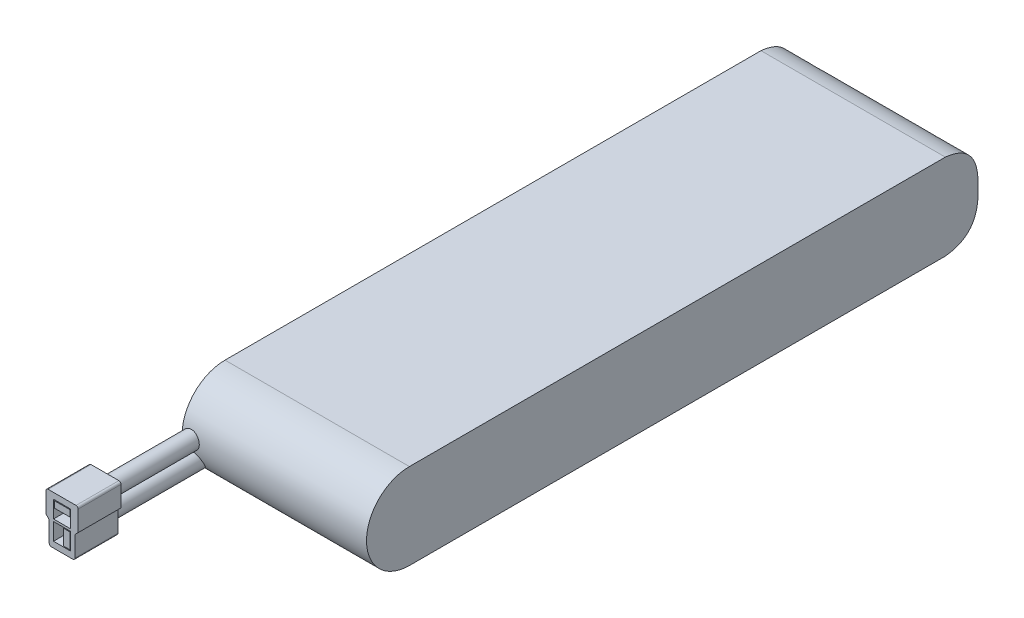
from build123d import *

# Parameters (mm, degrees)
BOSS_EXTRUDE1_DEPTH      = 21.5
BOSS_EXTRUDE2_REACH      = 167.249
BOSS_EXTRUDE2_END_RADIUS = 10
SKETCH2_R                = 2
SKETCH2_R_2              = 1.997930563
BOSS_EXTRUDE3_DEPTH      = 10
SKETCH4_W                = 4
SKETCH4_H                = 4
SKETCH4_W_2              = 3.997930563
SKETCH4_H_2              = 3.995861126
CUT_EXTRUDE1_DEPTH       = 5
SKETCH5_W                = 3.6
SKETCH5_H                = 1.5
SKETCH5_W_2              = 1.5
SKETCH5_H_2              = 3.595861126
BOSS_EXTRUDE4_DEPTH      = 5


with BuildPart() as part:
    # Sketch1 → Boss-Extrude1 (new, symmetric)
    with BuildSketch(Plane(origin=(0, 0, 0), x_dir=(0, 0, -1), z_dir=(1, 0, 0))):
        with BuildLine():
            Line((0, 0), (125, 0))
            add(Edge.make_bspline(
                [(125, 0), (133.151261209, 0.831442108), (132.582471807, 10)],
                knots=[0, 0, 0, 1, 1, 1], degree=2))
            add(Edge.make_bspline(
                [(125, 20), (133.151261209, 19.168557892), (132.582471807, 10)],
                knots=[0, 0, 0, 1, 1, 1], degree=2))
            Line((125, 20), (0, 20))
            ThreePointArc((0, 20), (-10, 10), (0, 0))
        make_face()
    extrude(amount=BOSS_EXTRUDE1_DEPTH, both=True)

    # Boss-Extrude2: up to this cylinder (the profile starts outside it)
    boss_extrude2_end = Plane(origin=(-19.502069, 10, 0), z_dir=(-1, 0, 0)) * Cylinder(BOSS_EXTRUDE2_END_RADIUS, 355.498, mode=Mode.PRIVATE)
    # Sketch2 → Boss-Extrude2 (add, up to the surface)
    with BuildSketch(Plane.XY.offset(30), mode=Mode.PRIVATE) as boss_extrude2_sk1:
        with Locations((-19.502069437, 9.909041412)):
            Circle(SKETCH2_R)
    boss_extrude2_tool1 = extrude(boss_extrude2_sk1.sketch, amount=-BOSS_EXTRUDE2_REACH, mode=Mode.PRIVATE) - boss_extrude2_end
    add(boss_extrude2_tool1.solids().sort_by_distance((-19.502069, 9.909041, 30))[0])
    # Sketch2 → Boss-Extrude2 (add, up to the surface)
    with BuildSketch(Plane.XY.offset(30), mode=Mode.PRIVATE) as boss_extrude2_sk2:
        with Locations((-19.502069437, 5.409041412)):
            Circle(SKETCH2_R_2)
    boss_extrude2_tool2 = extrude(boss_extrude2_sk2.sketch, amount=-BOSS_EXTRUDE2_REACH, mode=Mode.PRIVATE) - boss_extrude2_end
    add(boss_extrude2_tool2.solids().sort_by_distance((-19.502069, 5.409041, 30))[0])

    # Sketch3 → Boss-Extrude3 (add)
    with BuildSketch(Plane.XY.offset(30)):
        with BuildLine():
            Line((-17.002069437, 2.029329274), (-22.002069437, 2.029329274))
            ThreePointArc((-22.002069437, 2.029329274), (-22.355622827, 2.175775884), (-22.502069437, 2.529329274))
            Line((-22.502069437, 2.529329274), (-22.502069437, 7.279329274))
            Line((-22.502069437, 7.279329274), (-23.252069437, 8.029329274))
            Line((-23.252069437, 8.029329274), (-23.252069437, 12.779329274))
            ThreePointArc((-23.252069437, 12.779329274), (-23.105622827, 13.132882665), (-22.752069437, 13.279329274))
            Line((-22.752069437, 13.279329274), (-16.252069437, 13.279329274))
            ThreePointArc((-16.252069437, 13.279329274), (-15.898516046, 13.132882665), (-15.752069437, 12.779329274))
            Line((-15.752069437, 12.779329274), (-15.752069437, 8.029329274))
            Line((-15.752069437, 8.029329274), (-16.502069437, 7.279329274))
            Line((-16.502069437, 7.279329274), (-16.502069437, 2.529329274))
            ThreePointArc((-16.502069437, 2.529329274), (-16.648516046, 2.175775884), (-17.002069437, 2.029329274))
        make_face()
    extrude(amount=BOSS_EXTRUDE3_DEPTH)

    # Sketch4 → Cut-Extrude1 (cut)
    with BuildSketch(Plane.XY.offset(40)):
        with Locations((-19.502069437, 9.909041412)):
            Rectangle(SKETCH4_W, SKETCH4_H)
        with Locations((-19.501034719, 5.409041412)):
            Rectangle(SKETCH4_W_2, SKETCH4_H_2)
    extrude(amount=-CUT_EXTRUDE1_DEPTH, mode=Mode.SUBTRACT)

    # Sketch5 → Boss-Extrude4 (add)
    with BuildSketch(Plane.XY.offset(35)):
        with Locations((-19.502069437, 10.959041412)):
            Rectangle(SKETCH5_W, SKETCH5_H)
        with Locations((-18.452069437, 5.409041412)):
            Rectangle(SKETCH5_W_2, SKETCH5_H_2)
    extrude(amount=BOSS_EXTRUDE4_DEPTH)


solid = part.part
